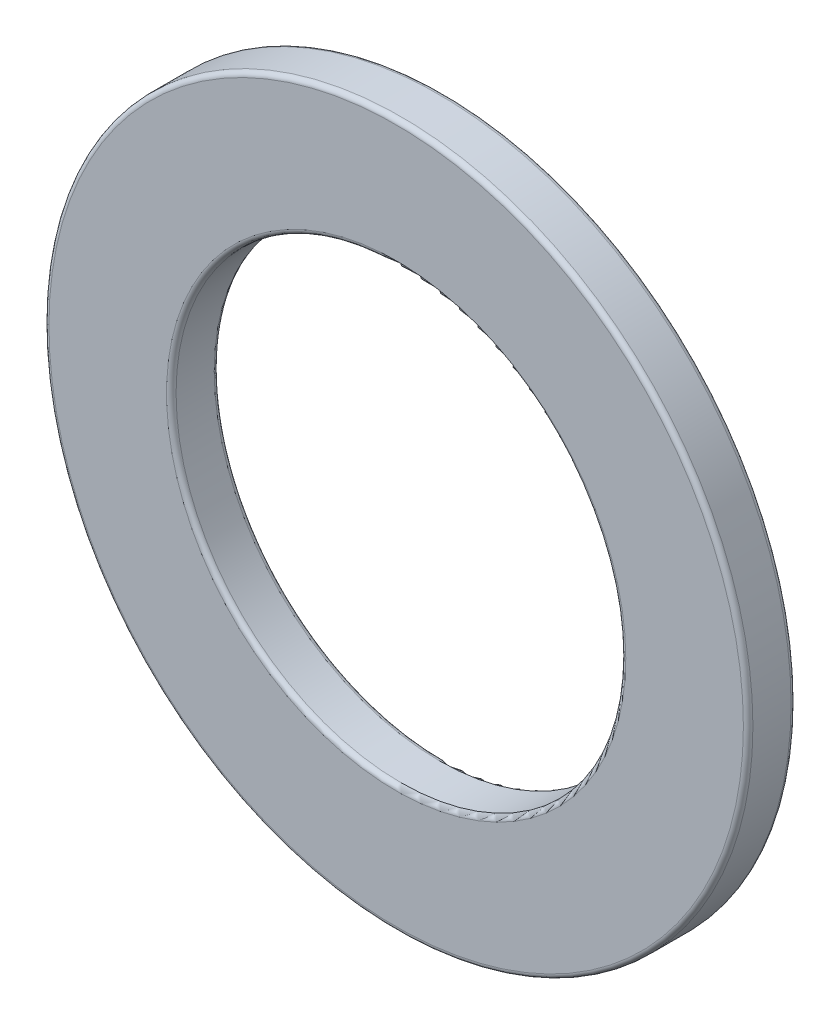
from build123d import *

# Parameters (mm, degrees)
SKETCH1_R          = 11.075
SKETCH1_R_2        = 7.075
BASE_FLANGE1_DEPTH = 1.5
FILLET1_R          = 0.15


# Sheet-metal steps are written as plain solids
with BuildPart() as part:
    # Sketch1 → Base-Flange1 (new body)
    with BuildSketch(Plane.XY):
        Circle(SKETCH1_R)
        Circle(SKETCH1_R_2, mode=Mode.SUBTRACT)
    extrude(amount=-BASE_FLANGE1_DEPTH)

    # Fillet1
    fillet1_edges = [part.edges().sort_by_distance(p)[0] for p in [
        (-11.075, 0, 0),
        (-11.075, 0, -1.5),
        (-7.075, 0, -1.5),
        (-7.075, 0, 0),
    ]]
    fillet(fillet1_edges, radius=FILLET1_R)


solid = part.part
